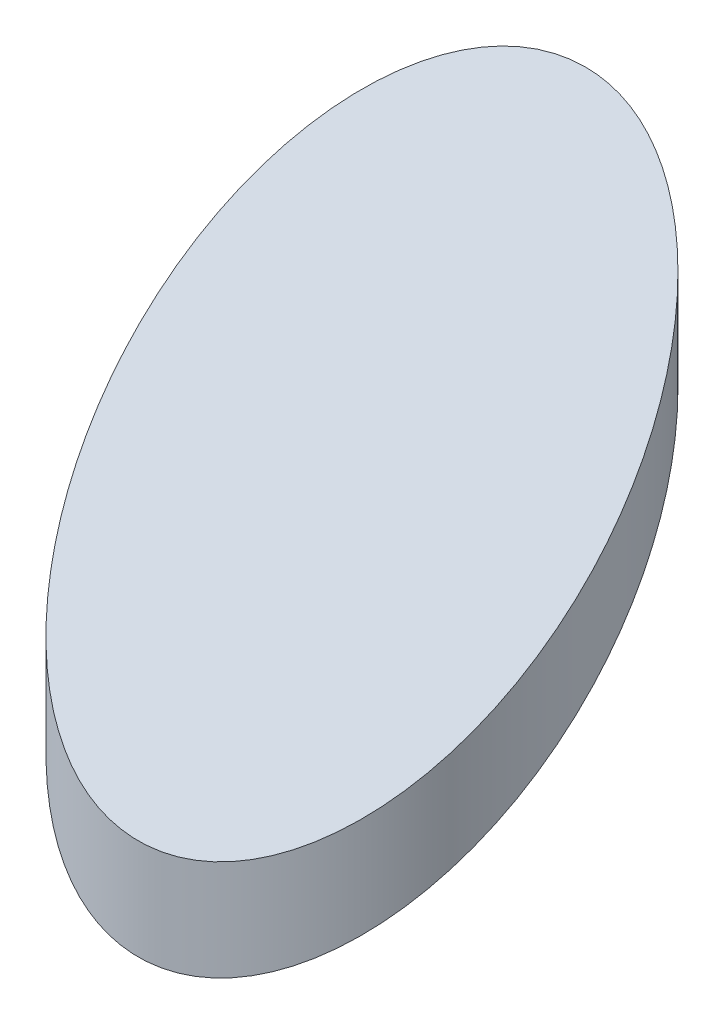
from build123d import *

# Parameters (mm, degrees)
SKETCH2_R               = 20
BOSS_EXTRUDE1_DEPTH     = 2
CUT_EXTRUDE2_DEPTH      = 46.628938186
CUT_EXTRUDE2_DEPTH_BACK = 46.628938186
SKETCH6_R               = 25.059608459
SKETCH6_R_2             = 6.28
SKETCH3_R               = 7.4
SKETCH3_R_2             = 5.9
BOSS_EXTRUDE2_DEPTH     = 1
SKETCH7_R               = 13.022061682
CUT_EXTRUDE3_DEPTH      = 1


with BuildPart() as part:
    # Sketch2 → Boss-Extrude1 (new body)
    with BuildSketch(Plane(origin=(0, 0, 0), x_dir=(1, 0, 0), z_dir=(0, 0.7071067811865464, 0.7071067811865488))):
        with Locations((0, 20)):
            Circle(SKETCH2_R)
    extrude(amount=-BOSS_EXTRUDE1_DEPTH)

    # Sketch6 → Cut-Extrude2 (cut, two sides: drawn at the far end of the back side and taken through both)
    with BuildSketch(Plane(origin=(0, 0, 0), x_dir=(1, 0, 0), z_dir=(0, 1, 0)).offset(-CUT_EXTRUDE2_DEPTH_BACK)):
        with Locations((0, 9)):
            Circle(SKETCH6_R)
        with Locations((0, 9)):
            Circle(SKETCH6_R_2, mode=Mode.SUBTRACT)
    extrude(amount=CUT_EXTRUDE2_DEPTH + CUT_EXTRUDE2_DEPTH_BACK, mode=Mode.SUBTRACT)


with BuildPart() as body_2:
    # Sketch3 → Boss-Extrude2 (new body)
    with BuildSketch(Plane(origin=(0, -3.25, 0), x_dir=(1, 0, 0), z_dir=(0, 1, 0))):
        with Locations((0, 7.4)):
            Circle(SKETCH3_R)
        with Locations((0, 7.4)):
            Circle(SKETCH3_R_2, mode=Mode.SUBTRACT)
    extrude(amount=BOSS_EXTRUDE2_DEPTH)

    # Sketch7 → Cut-Extrude3 (cut)
    with BuildSketch(Plane.XZ.offset(3.25)):
        with Locations((0.290894274, -7.517427113)):
            Circle(SKETCH7_R)
    extrude(amount=-CUT_EXTRUDE3_DEPTH, mode=Mode.SUBTRACT)


solid = part.part
